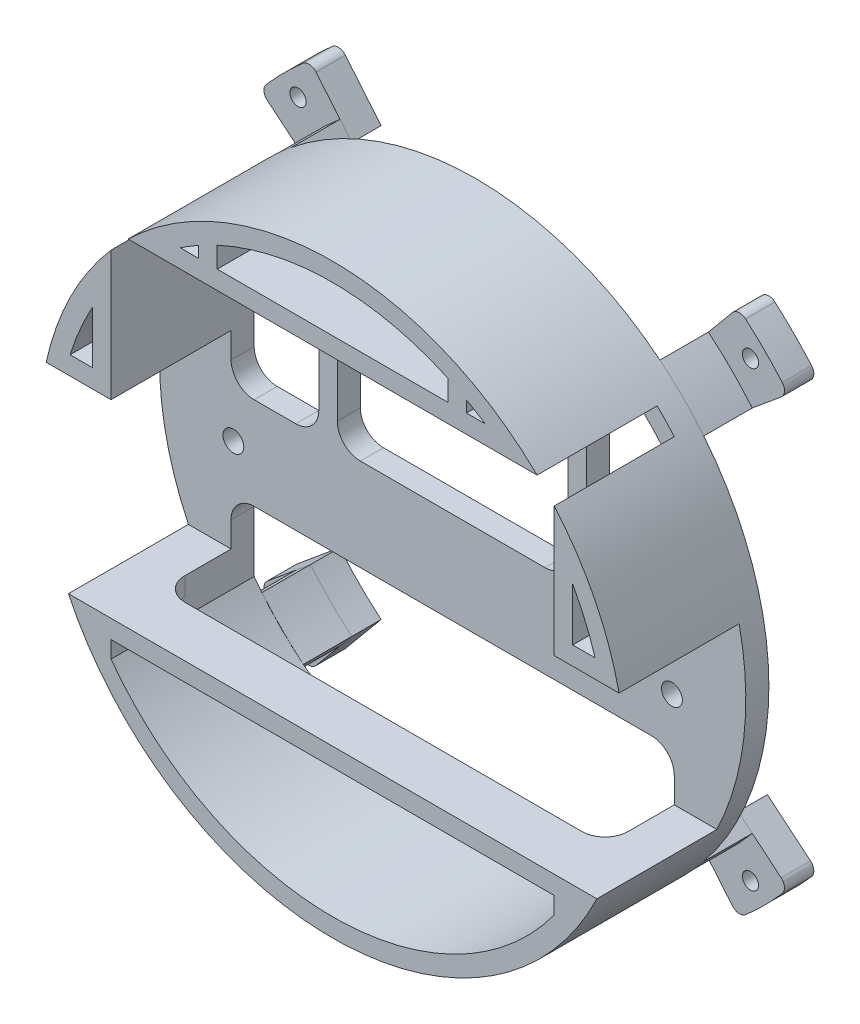
from build123d import *
from build123d.topology import SkipClean

# Parameters (mm, degrees)
BOSS_EXTRUDE1_DEPTH   = 31
BOSS_EXTRUDE3_DEPTH   = 10
BOSS_EXTRUDE4_DEPTH   = 5
SKETCH6_W             = 19
SKETCH6_H             = 10.5
SKETCH6_R             = 2.25
SKETCH6_W_2           = 50
SKETCH6_W_3           = 96
CUT_EXTRUDE1_DEPTH    = 94.490641243
CUT_EXTRUDE2_DEPTH    = 10
SKETCH9_W             = 96
SKETCH9_H             = 4
SKETCH9_W_2           = 19
SKETCH9_W_3           = 50
CUT_EXTRUDE4_DEPTH    = 20
BOSS_EXTRUDE5_DEPTH   = 31
FILLET3_R             = 5
SKETCH11_W            = 96
SKETCH11_H            = 42.5
CUT_EXTRUDE5_DEPTH    = 26
BOSS_EXTRUDE6_DEPTH   = 10.5
BOSS_EXTRUDE7_DEPTH   = 6.35
BOSS_EXTRUDE7_2_DEPTH = 6.35
BOSS_EXTRUDE7_3_DEPTH = 6.35
BOSS_EXTRUDE7_4_DEPTH = 6.35
FILLET4_R             = 2
FILLET7_R             = 2
FILLET8_R             = 2
FILLET9_R             = 2


with BuildPart() as part:
    # Sketch1 → Boss-Extrude1 (new body)
    with BuildSketch(Plane.XY):
        with BuildLine():
            ThreePointArc((-50.477717856, -31.5), (-51.659400485, -29.522133079), (-52.763623833, -27.5))
            Line((-52.763623833, -27.5), (-57.236352085, -27.5))
            ThreePointArc((-57.236352085, -27.5), (0, -63.5), (57.236352085, -27.5))
            Line((57.236352085, -27.5), (52.763623833, -27.5))
            ThreePointArc((52.763623833, -27.5), (51.659400485, -29.522133079), (50.477717856, -31.5))
            ThreePointArc((50.477717856, -31.5), (49.272860314, -33.353189299), (48, -35.160346983))
            ThreePointArc((48, -35.160346983), (0, -59.5), (-48, -35.160346983))
            ThreePointArc((-48, -35.160346983), (-49.272860314, -33.353189299), (-50.477717856, -31.5))
        make_face()
        with BuildLine():
            Line((52.763623833, -27.5), (-52.763623833, -27.5))
            ThreePointArc((-52.763623833, -27.5), (-51.659400485, -29.522133079), (-50.477717856, -31.5))
            Line((-50.477717856, -31.5), (-48, -31.5))
            Line((-48, -31.5), (48, -31.5))
            Line((48, -31.5), (50.477717856, -31.5))
            ThreePointArc((50.477717856, -31.5), (51.659400485, -29.522133079), (52.763623833, -27.5))
        make_face()
        with BuildLine():
            ThreePointArc((-56.868268832, 17.5), (-57.443088433, 15.50940332), (-57.948252778, 13.5))
            Line((-57.948252778, 13.5), (57.948252778, 13.5))
            ThreePointArc((57.948252778, 13.5), (57.443088433, 15.50940332), (56.868268832, 17.5))
            Line((56.868268832, 17.5), (52, 17.5))
            Line((52, 17.5), (48, 17.5))
            Line((48, 17.5), (-48, 17.5))
            Line((-48, 17.5), (-52, 17.5))
            Line((-52, 17.5), (-56.868268832, 17.5))
        make_face()
        with BuildLine():
            Line((-52, 28.917987482), (-52, 17.5))
            Line((-52, 17.5), (-48, 17.5))
            Line((-48, 17.5), (-48, 35.160346983))
            ThreePointArc((-48, 35.160346983), (-50.097322913, 32.101530134), (-52, 28.917987482))
        make_face()
        with BuildLine():
            Line((-62.04836823, 13.5), (-57.948252778, 13.5))
            ThreePointArc((-57.948252778, 13.5), (-57.443088433, 15.50940332), (-56.868268832, 17.5))
            ThreePointArc((-56.868268832, 17.5), (-54.732692234, 23.336289354), (-52, 28.917987482))
            ThreePointArc((-52, 28.917987482), (-50.097322913, 32.101530134), (-48, 35.160346983))
            Line((-48, 35.160346983), (-48, 41.572226306))
            ThreePointArc((-48, 41.572226306), (-56.78620704, 28.417893835), (-62.04836823, 13.5))
        make_face()
        with BuildLine():
            ThreePointArc((56.868268832, 17.5), (57.443088433, 15.50940332), (57.948252778, 13.5))
            Line((57.948252778, 13.5), (62.04836823, 13.5))
            ThreePointArc((62.04836823, 13.5), (56.78620704, 28.417893835), (48, 41.572226306))
            Line((48, 41.572226306), (48, 35.160346983))
            ThreePointArc((48, 35.160346983), (50.097322913, 32.101530134), (52, 28.917987482))
            ThreePointArc((52, 28.917987482), (54.732692234, 23.336289354), (56.868268832, 17.5))
        make_face()
        with BuildLine():
            Line((48, 17.5), (52, 17.5))
            Line((52, 17.5), (52, 28.917987482))
            ThreePointArc((52, 28.917987482), (50.097322913, 32.101530134), (48, 35.160346983))
            Line((48, 35.160346983), (48, 17.5))
        make_face()
        with BuildLine():
            ThreePointArc((44.294469181, 45.5), (0, 63.5), (-44.294469181, 45.5))
            Line((-44.294469181, 45.5), (-38.340579025, 45.5))
            ThreePointArc((-38.340579025, 45.5), (-35.733876731, 47.574573606), (-33.015148038, 49.5))
            ThreePointArc((-33.015148038, 49.5), (0, 59.5), (33.015148038, 49.5))
            ThreePointArc((33.015148038, 49.5), (35.733876731, 47.574573606), (38.340579025, 45.5))
            Line((38.340579025, 45.5), (44.294469181, 45.5))
        make_face()
        with BuildLine():
            ThreePointArc((-33.015148038, 49.5), (-35.733876731, 47.574573606), (-38.340579025, 45.5))
            Line((-38.340579025, 45.5), (38.340579025, 45.5))
            ThreePointArc((38.340579025, 45.5), (35.733876731, 47.574573606), (33.015148038, 49.5))
            Line((33.015148038, 49.5), (-33.015148038, 49.5))
        make_face()
        with BuildLine():
            ThreePointArc((48, -35.160346983), (49.272860314, -33.353189299), (50.477717856, -31.5))
            Line((50.477717856, -31.5), (48, -31.5))
            Line((48, -31.5), (48, -35.160346983))
        make_face()
        with BuildLine():
            Line((-48, -31.5), (-50.477717856, -31.5))
            ThreePointArc((-50.477717856, -31.5), (-49.272860314, -33.353189299), (-48, -35.160346983))
            Line((-48, -35.160346983), (-48, -31.5))
        make_face()
    extrude(amount=BOSS_EXTRUDE1_DEPTH)

    # Sketch2 → Boss-Extrude3 (add)
    with SkipClean():  # the faces are left unmerged after this step: merging them gives an invalid solid
        with BuildSketch(Plane(origin=(0, 0, 0), x_dir=(-1, 0, 0), z_dir=(0, 0, -1))):
            with BuildLine():
                ThreePointArc((48, 41.572226306), (46.189004231, 43.575519367), (44.294469181, 45.5))
                Line((44.294469181, 45.5), (25, 45.5))
                Line((25, 45.5), (25, 17.5))
                Line((25, 17.5), (48, 17.5))
                Line((48, 17.5), (48, 41.572226306))
            make_face()
            with BuildLine():
                Line((-25, 45.5), (-44.294469181, 45.5))
                ThreePointArc((-44.294469181, 45.5), (-46.189004231, 43.575519367), (-48, 41.572226306))
                Line((-48, 41.572226306), (-48, 17.5))
                Line((-48, 17.5), (-25, 17.5))
                Line((-25, 17.5), (-25, 45.5))
            make_face()
        extrude(amount=-BOSS_EXTRUDE3_DEPTH)

    # Sketch4 → Boss-Extrude4 (add)
    with SkipClean():  # the faces are left unmerged after this step: merging them gives an invalid solid
        with BuildSketch(Plane(origin=(0, 0, 0), x_dir=(-1, 0, 0), z_dir=(0, 0, -1))):
            with BuildLine():
                Line((-57.236352085, -27.5), (57.236352085, -27.5))
                ThreePointArc((57.236352085, -27.5), (63.067116036, -7.401950746), (62.04836823, 13.5))
                Line((62.04836823, 13.5), (-62.04836823, 13.5))
                ThreePointArc((-62.04836823, 13.5), (-63.067116036, -7.401950746), (-57.236352085, -27.5))
            make_face()
        extrude(amount=-BOSS_EXTRUDE4_DEPTH)

    # Sketch6 → Cut-Extrude1 (cut, through all)
    with SkipClean():  # the faces are left unmerged after this step: merging them gives an invalid solid
        with BuildSketch(Plane.XY.offset(5)):
            with Locations((-38.5, 8.25)):
                Rectangle(SKETCH6_W, SKETCH6_H)
            with Locations((-47.5, -7)):
                Circle(SKETCH6_R)
            with Locations((0, 8.25)):
                Rectangle(SKETCH6_W_2, SKETCH6_H)
            with Locations((0, -22.25)):
                Rectangle(SKETCH6_W_3, SKETCH6_H)
            with Locations((38.5, 8.25)):
                Rectangle(SKETCH6_W, SKETCH6_H)
            with Locations((47.5, -7)):
                Circle(SKETCH6_R)
        extrude(amount=-CUT_EXTRUDE1_DEPTH, mode=Mode.SUBTRACT)

    # Sketch7 → Cut-Extrude2 (cut)
    with SkipClean():  # the faces are left unmerged after this step: merging them gives an invalid solid
        with BuildSketch(Plane(origin=(0, 0, 0), x_dir=(-1, 0, 0), z_dir=(0, 0, -1))):
            with BuildLine():
                Line((-29, 17.5), (-48, 17.5))
                Line((-48, 17.5), (-48, 35.160346983))
                ThreePointArc((-48, 35.160346983), (-43.478741964, 40.618333265), (-38.340579025, 45.5))
                Line((-38.340579025, 45.5), (-29, 45.5))
                Line((-29, 45.5), (-29, 17.5))
            make_face()
            with BuildLine():
                Line((29, 17.5), (48, 17.5))
                Line((48, 17.5), (48, 35.160346983))
                ThreePointArc((48, 35.160346983), (43.478741964, 40.618333265), (38.340579025, 45.5))
                Line((38.340579025, 45.5), (29, 45.5))
                Line((29, 45.5), (29, 17.5))
            make_face()
        extrude(amount=-CUT_EXTRUDE2_DEPTH, mode=Mode.SUBTRACT)

    # Sketch9 → Cut-Extrude4 (cut)
    with SkipClean():  # the faces are left unmerged after this step: merging them gives an invalid solid
        with BuildSketch(Plane(origin=(0, 0, 0), x_dir=(-1, 0, 0), z_dir=(0, 0, -1))):
            with Locations((0, -29.5)):
                Rectangle(SKETCH9_W, SKETCH9_H)
            with Locations((-38.5, 15.5)):
                Rectangle(SKETCH9_W_2, SKETCH9_H)
            with Locations((0, 15.5)):
                Rectangle(SKETCH9_W_3, SKETCH9_H)
            with Locations((38.5, 15.5)):
                Rectangle(SKETCH9_W_2, SKETCH9_H)
            with Locations((0, 47.5)):
                Rectangle(SKETCH9_W_3, SKETCH9_H)
        extrude(amount=-CUT_EXTRUDE4_DEPTH, mode=Mode.SUBTRACT)

    # Sketch10 → Boss-Extrude5 (add)
    with SkipClean():  # the faces are left unmerged after this step: merging them gives an invalid solid
        with BuildSketch(Plane(origin=(0, 0, 0), x_dir=(-1, 0, 0), z_dir=(0, 0, -1))):
            with BuildLine():
                Line((-29.007574019, 51.950078436), (-29.007574019, 49.5))
                Line((-29.007574019, 49.5), (-25, 49.5))
                Line((-25, 49.5), (-25, 53.993055109))
                ThreePointArc((-25, 53.993055109), (-27.023100327, 53.009452447), (-29.007574019, 51.950078436))
            make_face()
            with BuildLine():
                ThreePointArc((29.007574019, 51.950078436), (27.023100327, 53.009452447), (25, 53.993055109))
                Line((25, 53.993055109), (25, 49.5))
                Line((25, 49.5), (29.007574019, 49.5))
                Line((29.007574019, 49.5), (29.007574019, 51.950078436))
            make_face()
        extrude(amount=-BOSS_EXTRUDE5_DEPTH)

    # Fillet3
    # the kernel refuses this fillet: 5 mm, written as the material it adds along each edge
    with BuildSketch(Plane(origin=(48, -17, 5), x_dir=(-1, 0, 0), z_dir=(0, 0, -1)), Plane(origin=(-48, -17, 5), x_dir=(0, -1, 0), z_dir=(0, 0, -1)), Plane(origin=(-29, 3, 5), x_dir=(0, 1, 0), z_dir=(0, 0, -1)), Plane(origin=(25, 3, 5), x_dir=(0, 1, 0), z_dir=(0, 0, -1)), Plane(origin=(48, 3, 5), x_dir=(0, 1, 0), z_dir=(0, 0, -1))) as fillet3_piece_1:
        with BuildLine():
            CenterArc((FILLET3_R, -FILLET3_R), FILLET3_R, 90, 90)
            Line((0, -FILLET3_R), (0, 0))
            Line((0, 0), (FILLET3_R, 0))
        make_face()
    extrude(amount=5)
    with BuildSketch(Plane(origin=(-48, 3, 5), x_dir=(0, 1, 0), z_dir=(0, 0, -1)), Plane(origin=(-25, 3, 5), x_dir=(0, 1, 0), z_dir=(0, 0, -1)), Plane(origin=(29, 3, 5), x_dir=(0, 1, 0), z_dir=(0, 0, -1))) as fillet3_piece_2:
        with BuildLine():
            CenterArc((FILLET3_R, FILLET3_R), FILLET3_R, 180, 90)
            Line((0, FILLET3_R), (0, 0))
            Line((0, 0), (FILLET3_R, 0))
        make_face()
    extrude(amount=5)
    with BuildSketch(Plane(origin=(48, -31.5, 20), x_dir=(0, 0, -1), z_dir=(0, 1, 0)), Plane(origin=(25, 49.5, 20), x_dir=(-1, 0, 0), z_dir=(0, -1, 0)), Plane(origin=(-29, 13.5, 20), x_dir=(0, 0, -1), z_dir=(0, 1, 0)), Plane(origin=(-48, 17.5, 20), x_dir=(0, 0, -1), z_dir=(0, -1, 0)), Plane(origin=(25, 13.5, 20), x_dir=(0, 0, -1), z_dir=(0, 1, 0))) as fillet3_piece_3:
        with BuildLine():
            CenterArc((FILLET3_R, FILLET3_R), FILLET3_R, 180, 90)
            Line((0, FILLET3_R), (0, 0))
            Line((0, 0), (FILLET3_R, 0))
        make_face()
    extrude(amount=4)
    with BuildSketch(Plane(origin=(-48, -27.5, 20), x_dir=(1, 0, 0), z_dir=(0, -1, 0)), Plane(origin=(-25, 45.5, 20), x_dir=(0, 0, -1), z_dir=(0, 1, 0)), Plane(origin=(-25, 17.5, 20), x_dir=(1, 0, 0), z_dir=(0, -1, 0)), Plane(origin=(48, 13.5, 20), x_dir=(-1, 0, 0), z_dir=(0, 1, 0)), Plane(origin=(29, 17.5, 20), x_dir=(1, 0, 0), z_dir=(0, -1, 0))) as fillet3_piece_4:
        with BuildLine():
            CenterArc((FILLET3_R, -FILLET3_R), FILLET3_R, 90, 90)
            Line((0, -FILLET3_R), (0, 0))
            Line((0, 0), (FILLET3_R, 0))
        make_face()
    extrude(amount=4)

    # Sketch11 → Cut-Extrude5 (cut)
    with BuildSketch(Plane.XY.offset(31)):
        with Locations((0, 24.25)):
            Rectangle(SKETCH11_W, SKETCH11_H)
    extrude(amount=-CUT_EXTRUDE5_DEPTH, mode=Mode.SUBTRACT)

    # Sketch12 → Boss-Extrude6 (add)
    with BuildSketch(Plane(origin=(0, 0, 0), x_dir=(-1, 0, 0), z_dir=(0, 0, -1))):
        with BuildLine():
            Line((46.322696115, -37.342439994), (49.399691297, -39.898878427))
            ThreePointArc((49.399691297, -39.898878427), (44.8682987, -44.8682987), (39.898878427, -49.399691297))
            Line((39.898878427, -49.399691297), (37.342439994, -46.322696115))
            ThreePointArc((37.342439994, -46.322696115), (42.039581957, -42.039581957), (46.322696115, -37.342439994))
        make_face()
        with BuildLine():
            Line((-46.322696115, -37.342439994), (-49.399691297, -39.898878427))
            ThreePointArc((-49.399691297, -39.898878427), (-44.8682987, -44.8682987), (-39.898878427, -49.399691297))
            Line((-39.898878427, -49.399691297), (-37.342439994, -46.322696115))
            ThreePointArc((-37.342439994, -46.322696115), (-42.039581957, -42.039581957), (-46.322696115, -37.342439994))
        make_face()
        with BuildLine():
            Line((-37.342439994, 46.322696115), (-39.898878427, 49.399691297))
            ThreePointArc((-39.898878427, 49.399691297), (-44.8682987, 44.8682987), (-49.399691297, 39.898878427))
            Line((-49.399691297, 39.898878427), (-46.322696115, 37.342439994))
            ThreePointArc((-46.322696115, 37.342439994), (-42.039581957, 42.039581957), (-37.342439994, 46.322696115))
        make_face()
        with BuildLine():
            Line((46.322696115, 37.342439994), (49.399691297, 39.898878427))
            ThreePointArc((49.399691297, 39.898878427), (44.8682987, 44.8682987), (39.898878427, 49.399691297))
            Line((39.898878427, 49.399691297), (37.342439994, 46.322696115))
            ThreePointArc((37.342439994, 46.322696115), (42.039581957, 42.039581957), (46.322696115, 37.342439994))
        make_face()
    extrude(amount=BOSS_EXTRUDE6_DEPTH)


with BuildPart() as body_2:
    # Sketch14 → Boss-Extrude7 (new body)
    with BuildSketch(Plane(origin=(0, 0, -10.5), x_dir=(-1, 0, 0), z_dir=(0, 0, -1))):
        with BuildLine():
            Line((57.214458866, -46.391567227), (46.322696115, -37.342439994))
            ThreePointArc((46.322696115, -37.342439994), (42.039581957, -42.039581957), (37.342439994, -46.322696115))
            Line((37.342439994, -46.322696115), (46.391567227, -57.214458866))
            ThreePointArc((46.391567227, -57.214458866), (52.052503596, -52.052503596), (57.214458866, -46.391567227))
        make_face()
        with BuildLine():
            ThreePointArc((50.236653382, -50.236653382), (47.761779648, -50.236653382), (47.761779648, -47.761779648))
            ThreePointArc((47.761779648, -47.761779648), (50.236653382, -47.761779648), (50.236653382, -50.236653382))
        make_face(mode=Mode.SUBTRACT)
    extrude(amount=BOSS_EXTRUDE7_DEPTH)

    # Fillet8
    fillet8_edges = [body_2.edges().sort_by_distance(p)[0] for p in [
        (-46.391567227, -57.214458866, -13.675),
        (-57.214458866, -46.391567227, -13.675),
    ]]
    fillet(fillet8_edges, radius=FILLET8_R)


with BuildPart() as body_3:
    # Sketch14 → Boss-Extrude7 2 (new body)
    with BuildSketch(Plane(origin=(0, 0, -10.5), x_dir=(-1, 0, 0), z_dir=(0, 0, -1))):
        with BuildLine():
            Line((-46.391567227, -57.214458866), (-37.342439994, -46.322696115))
            ThreePointArc((-37.342439994, -46.322696115), (-42.039581957, -42.039581957), (-46.322696115, -37.342439994))
            Line((-46.322696115, -37.342439994), (-57.214458866, -46.391567227))
            ThreePointArc((-57.214458866, -46.391567227), (-52.052503596, -52.052503596), (-46.391567227, -57.214458866))
        make_face()
        with BuildLine():
            ThreePointArc((-50.236653382, -50.236653382), (-50.236653382, -47.761779648), (-47.761779648, -47.761779648))
            ThreePointArc((-47.761779648, -47.761779648), (-47.761779648, -50.236653382), (-50.236653382, -50.236653382))
        make_face(mode=Mode.SUBTRACT)
    extrude(amount=BOSS_EXTRUDE7_2_DEPTH)

    # Fillet7
    fillet7_edges = [body_3.edges().sort_by_distance(p)[0] for p in [
        (46.391567227, -57.214458866, -13.675),
        (57.214458866, -46.391567227, -13.675),
    ]]
    fillet(fillet7_edges, radius=FILLET7_R)


with BuildPart() as body_4:
    # Sketch14 → Boss-Extrude7 3 (new body)
    with BuildSketch(Plane(origin=(0, 0, -10.5), x_dir=(-1, 0, 0), z_dir=(0, 0, -1))):
        with BuildLine():
            Line((-57.214458866, 46.391567227), (-46.322696115, 37.342439994))
            ThreePointArc((-46.322696115, 37.342439994), (-42.039581957, 42.039581957), (-37.342439994, 46.322696115))
            Line((-37.342439994, 46.322696115), (-46.391567227, 57.214458866))
            ThreePointArc((-46.391567227, 57.214458866), (-52.052503596, 52.052503596), (-57.214458866, 46.391567227))
        make_face()
        with BuildLine():
            ThreePointArc((-50.236653382, 50.236653382), (-47.761779648, 50.236653382), (-47.761779648, 47.761779648))
            ThreePointArc((-47.761779648, 47.761779648), (-50.236653382, 47.761779648), (-50.236653382, 50.236653382))
        make_face(mode=Mode.SUBTRACT)
    extrude(amount=BOSS_EXTRUDE7_3_DEPTH)

    # Fillet4
    fillet4_edges = [body_4.edges().sort_by_distance(p)[0] for p in [
        (57.214458866, 46.391567227, -13.675),
        (46.391567227, 57.214458866, -13.675),
    ]]
    fillet(fillet4_edges, radius=FILLET4_R)


with BuildPart() as body_5:
    # Sketch14 → Boss-Extrude7 4 (new body)
    with BuildSketch(Plane(origin=(0, 0, -10.5), x_dir=(-1, 0, 0), z_dir=(0, 0, -1))):
        with BuildLine():
            Line((46.391567227, 57.214458866), (37.342439994, 46.322696115))
            ThreePointArc((37.342439994, 46.322696115), (42.039581957, 42.039581957), (46.322696115, 37.342439994))
            Line((46.322696115, 37.342439994), (57.214458866, 46.391567227))
            ThreePointArc((57.214458866, 46.391567227), (52.052503596, 52.052503596), (46.391567227, 57.214458866))
        make_face()
        with BuildLine():
            ThreePointArc((50.236653382, 50.236653382), (50.236653382, 47.761779648), (47.761779648, 47.761779648))
            ThreePointArc((47.761779648, 47.761779648), (47.761779648, 50.236653382), (50.236653382, 50.236653382))
        make_face(mode=Mode.SUBTRACT)
    extrude(amount=BOSS_EXTRUDE7_4_DEPTH)

    # Fillet9
    fillet9_edges = [body_5.edges().sort_by_distance(p)[0] for p in [
        (-46.391567227, 57.214458866, -13.675),
        (-57.214458866, 46.391567227, -13.675),
    ]]
    fillet(fillet9_edges, radius=FILLET9_R)


solid = Compound([part.part, body_2.part, body_3.part, body_4.part, body_5.part])
